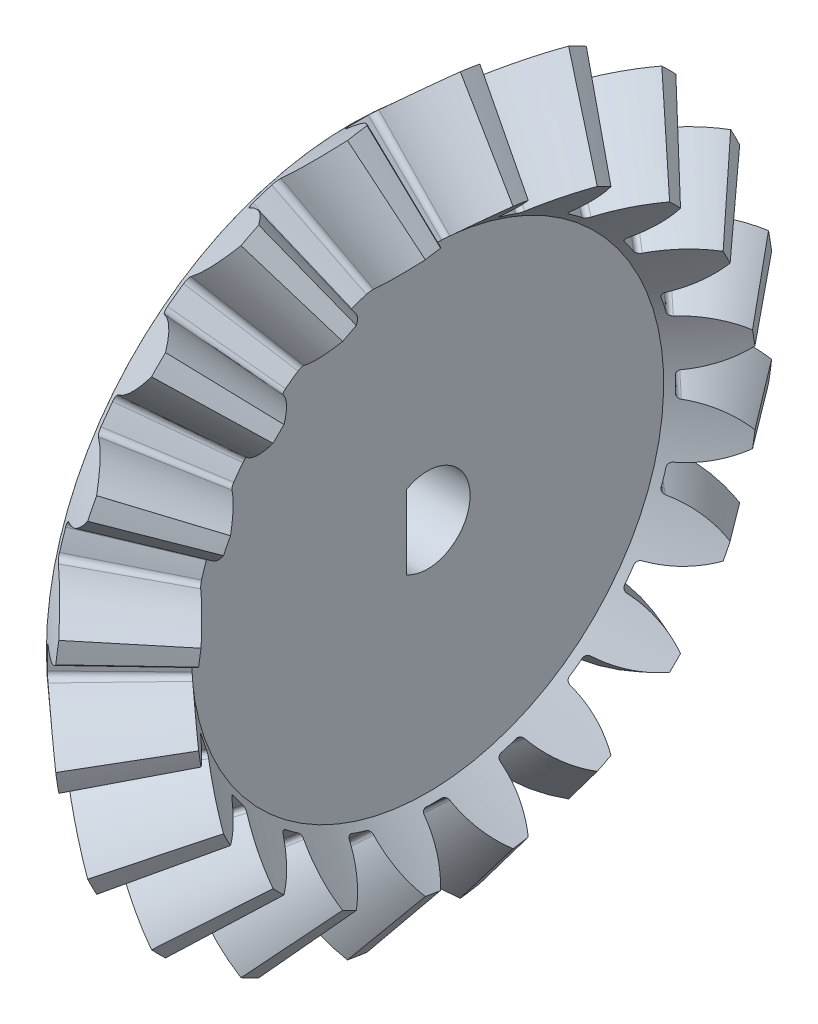
from build123d import *

# Parameters (mm, degrees)
TEETHCUTS_COUNT     = 20
TEETHCUTS_ANGLE     = 342
HUBSKE_R            = 35.733175701
HUB_DEPTH           = 0.0001016
BORSKE_R            = 5
BORE_DEPTH          = 40.740966688
BOSS_EXTRUDE1_DEPTH = 9.084847


with BuildPart() as part:
    # BasProSke → Base-Revolve (revolve)
    with BuildSketch(Plane(origin=(0, 0, 0), x_dir=(1, 0, 0), z_dir=(0, 1, 0)), mode=Mode.PRIVATE) as base_revolve_sk:
        Polygon((0, 0), (0, 35.733175705), (7.454236846, 42.441988854), (14.876774942, 32.977924285), (9.084745281, 27.7650976), (9.084745281, 0), align=None)
    revolve(base_revolve_sk.sketch.rotate(Axis((-10, 0, 0), (1, 0, 0)), 180), axis=Axis((-10, 0, 0), (1, 0, 0)))

    # ToothCut: read off the stored shape, not the designer's step
    # ToothCut: loft between two sections, ruled curve by curve
    toothcut_from = [
        Edge.make_bspline([(40.747455018, 0.005885213, -0.009159323), (40.742990475, 0.001867124, -0.014928507), (40.736826796, -0.003680187, -0.014155803), (40.733231408, -0.006916036, -0.007376192)], [0, 0, 0, 0, 1, 1, 1, 1], 3, [1, 0.769216507, 0.769216507, 1]),
        Edge.make_bspline([(40.733231408, -0.006916036, 0.007376192), (40.736826796, -0.003680187, 0.014155803), (40.742990475, 0.001867124, 0.014928507), (40.747455018, 0.005885213, 0.009159323)], [0, 0, 0, 0, 1, 1, 1, 1], 3, [1, 0.769216507, 0.769216507, 1]),
        Edge.make_bspline([(40.733231408, -0.006916036, -0.007376192), (40.732708706, -0.007386468, -0.006390564), (40.732295363, -0.007758477, -0.005315044), (40.73199976, -0.008024519, -0.004171441)], [0, 0, 0, 0, 1, 1, 1, 1], 3, [1, 0.993240728, 0.993240728, 1]),
        Edge.make_bspline([(40.73199976, -0.008024519, 0.004171441), (40.732295363, -0.007758477, 0.005315044), (40.732708706, -0.007386468, 0.006390564), (40.733231408, -0.006916036, 0.007376192)], [0, 0, 0, 0, 1, 1, 1, 1], 3, [1, 0.993240728, 0.993240728, 1]),
        Edge.make_bspline([(40.73199976, -0.008024519, -0.004171441), (40.731294732, -0.008659044, -0.001443887), (40.731294732, -0.008659044, 0.001443887), (40.73199976, -0.008024519, 0.004171441)], [0, 0, 0, 0, 1, 1, 1, 1], 3, [1, 0.963011933, 0.963011933, 1]),
        Edge.make_line((40.747455018, 0.005885213, 0.009159323), (40.747455018, 0.005885213, -0.009159323)),
    ]
    toothcut_to = [
        Edge.make_bspline([(7.789841671, 42.744033196, -6.111905124), (6.014659654, 41.146369384, -3.861443953), (3.821309872, 39.172354584, -2.425874856), (1.409515719, 37.00173985, -1.935918766)], [0, 0, 0, 0, 1, 1, 1, 1], 3, [1, 0.969647128, 0.969647128, 1]),
        Edge.make_bspline([(1.409515719, 37.00173985, 1.935918766), (3.821309872, 39.172354584, 2.425874856), (6.014659654, 41.146369384, 3.861443953), (7.789841671, 42.744033196, 6.111905124)], [0, 0, 0, 0, 1, 1, 1, 1], 3, [1, 0.969647128, 0.969647128, 1]),
        Edge.make_bspline([(1.409515719, 37.00173985, -1.935918766), (1.114502607, 36.73622805, -1.875986839), (0.923724939, 36.564528148, -1.567370389), (0.9336954, 36.573501564, -1.166195669)], [0, 0, 0, 0, 1, 1, 1, 1], 3, [1, 0.8313697, 0.8313697, 1]),
        Edge.make_bspline([(0.9336954, 36.573501564, 1.166195669), (0.923724939, 36.564528148, 1.567370389), (1.114502607, 36.73622805, 1.875986839), (1.409515719, 37.00173985, 1.935918766)], [0, 0, 0, 0, 1, 1, 1, 1], 3, [1, 0.8313697, 0.8313697, 1]),
        Edge.make_bspline([(0.9336954, 36.573501564, -1.166195669), (0.953014237, 36.590888517, -0.38887669), (0.953014237, 36.590888517, 0.38887669), (0.9336954, 36.573501564, 1.166195669)], [0, 0, 0, 0, 1, 1, 1, 1], 3, [1, 0.999627645, 0.999627645, 1]),
        Edge.make_line((7.789841671, 42.744033196, 6.111905124), (7.789841671, 42.744033196, -6.111905124)),
    ]
    toothcut = Solid(Shell([*[Face.make_surface_from_curves(toothcut_from[k], toothcut_to[k]) for k in range(6)], Face(Wire(toothcut_from)), Face(Wire(toothcut_to))]))
    add(toothcut, mode=Mode.SUBTRACT)

    # TeethCuts: ToothCut ×20 about axis
    teethcuts_axis = Axis((-10, 0, 0), (1, 0, 0))
    for i in range(1, TEETHCUTS_COUNT):
        add(toothcut.rotate(teethcuts_axis, i * TEETHCUTS_ANGLE / (TEETHCUTS_COUNT - 1)), mode=Mode.SUBTRACT)

    # HubSke → Hub (add)
    with BuildSketch(Plane.ZY):
        Circle(HUBSKE_R)
    extrude(amount=HUB_DEPTH)

    # BorSke → Bore (cut, symmetric)
    with BuildSketch(Plane(origin=(0, 0, 0), x_dir=(0, 0, -1), z_dir=(1, 0, 0))):
        with Locations(Location((0, 0, 0), (0, 0, 180))):
            Circle(BORSKE_R)
    extrude(amount=BORE_DEPTH, both=True, mode=Mode.SUBTRACT)

    # Sketch1 → Boss-Extrude1 (add, through all)
    with BuildSketch(Plane(origin=(9.084745281, 0, 0), x_dir=(0, 0, -1), z_dir=(1, 0, 0))):
        with BuildLine():
            Line((-2.5, 0), (-2.5, 4.330127019))
            ThreePointArc((-2.5, 4.330127019), (-5, 0), (-2.5, -4.330127019))
            Line((-2.5, -4.330127019), (-2.5, 0))
        make_face()
    extrude(amount=-BOSS_EXTRUDE1_DEPTH)


solid = part.part
